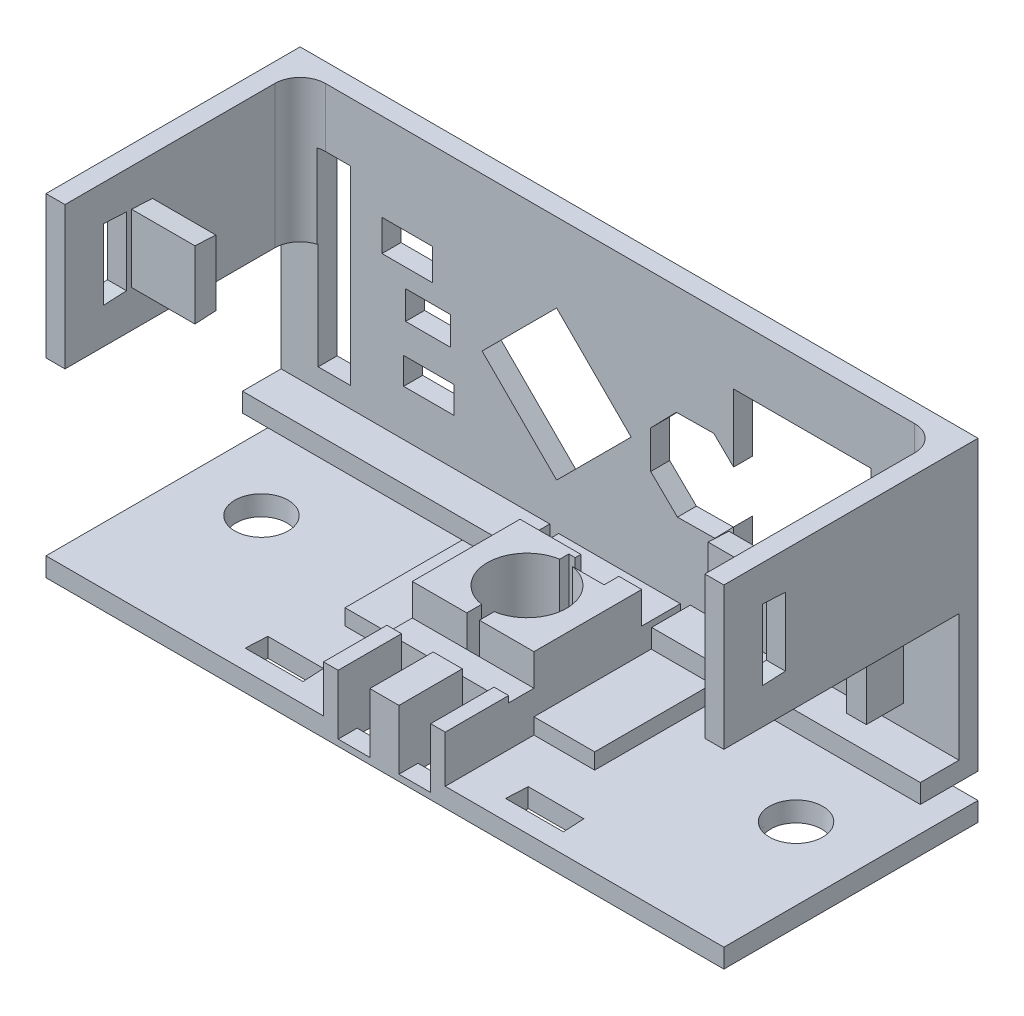
from build123d import *

# Parameters (mm, degrees)
SKETCH1_W                              = 53.48460998
SKETCH1_H                              = 26.25
FRONT_SIDE_MAIN_DEPTH                  = 1.5
RESET_HOLE_DEPTH                       = 3.75
SKETCH15_W                             = 3.966010581
SKETCH15_H                             = 2.112155191
SKETCH15_W_2                           = 3.557190409
SKETCH15_H_2                           = 2.236587576
SKETCH15_W_3                           = 3.981127105
SKETCH15_H_3                           = 2.476855865
COMPONENT_HOLES_DEPTH                  = 3.75
SKETCH16_W                             = 10.85
SKETCH16_H                             = 14.75
MICROPHONE_HOLE_DEPTH                  = 1.5
SKETCH24_W                             = 1.5
SKETCH24_H                             = 11.233042059
RIGHT_SIDE_TOP_DEPTH                   = 18.55
SNAP_GROOVE_RIGHT_DEPTH                = 1.5
SKETCH26_W                             = 1.5
SKETCH26_H                             = 11.23304206
LEFT_SIDE_TOP_DEPTH                    = 18.55
SNAP_START                             = 51.98460998
SNAP_GROOVE_LEFT_DEPTH                 = 1.5
SKETCH20_W                             = 53.48460998
SKETCH20_H                             = 1.5
BOTTOM_BASE_DEPTH                      = 18.55
SERVO_START                            = -1.5
SKETCH18_W                             = 9.6
SKETCH18_H                             = 3.2
SERVO_SEPERATOR_BOTTOM_DEPTH           = 20.05
SKETCH34_W                             = 2.537171882
SKETCH34_H                             = 15
PROGRAMMING_HOLE_DEPTH                 = 3.75
SKETCH38_W                             = 9.6
SKETCH38_H                             = 5
BACK_BATTERY_HOLDER_BOTTOM_DEPTH       = 0.50445794
SKETCH40_R                             = 2
SERVO_ARM_HOLES_BOTTOM_DEPTH           = 1.5
SERVO_ARM_HOLES_BOTTOM_DRAFT           = 4
SERVO_ARM_HOLES_BOTTOM_PROFILE_2_DEPTH = 1.5
SERVO_ARM_HOLES_BOTTOM_PROFILE_2_DRAFT = 4
SKETCH47_W                             = 11
SKETCH47_H                             = 2
SOLAR_ARM_HOLES_FRONT_DEPTH            = 1.5
FILLET1_R                              = 2
SKETCH48_W                             = 9.6
SKETCH48_H                             = 8.5
SERVO_TALLER_SEPERATOR_BOTTOM_DEPTH    = 2.5
SKETCH49_W                             = 1.573389805
SKETCH49_H                             = 10.535992885
SERVO_2_CASE_SPACER_FRONT_DEPTH        = 2.95
SKETCH51_W                             = 4.791370676
SKETCH51_H                             = 11.55
SKETCH51_W_2                           = 5.306259021
SERVO_LIFTERS_BOTTOM_DEPTH             = 1.25
SKETCH52_W                             = 21.2
SKETCH52_H                             = 1.5
SERVO_UNDER_SUPPORT_DEPTH              = 3.05
SERVO_TOP_SUPPORT_RIGHT_DEPTH          = 5
SERVO_TOP_SUPPORT_LEFT_DEPTH           = 5
SNAP_GROOVE_BOTTOM_RIGHT_DEPTH         = 1.5
SNAP_GROOVE_BOTTOM_LEFT_DEPTH          = 1.5
VIBRATION_MOTOR_AND_WIRE_HOLES_DEPTH   = 6.2
SKETCH57_W                             = 3
SKETCH57_H                             = 1.16525933
SKETCH57_W_2                           = 1
SKETCH57_H_2                           = 1.45
VIBRATION_WIRE_ROUTING_HOLES_DEPTH     = 2.5
SKETCH60_W                             = 2.5
SKETCH60_H                             = 5
COPPER_HOLES_DEPTH                     = 4.70445794
SKETCH61_W                             = 2.5
SKETCH61_H                             = 2
CUT_EXTRUDE5_DEPTH                     = 0.5
SKETCH62_R                             = 1.25
BOSS_EXTRUDE1_DEPTH                    = 0.6
CUT_EXTRUDE7_START                     = -3.7
CUT_EXTRUDE7_DEPTH                     = 3.7


# Read off the part's stored shape, not the designer's step: Snap Groove - Right, Snap Groove - Left, Snap Groove - Bottom Right, Snap Groove - Bottom Left, Cut-Extrude7
with BuildPart() as part:
    # Sketch1 → Front Side - Main (new body)
    with BuildSketch(Plane.XY):
        with Locations((26.74230499, 13.125)):
            Rectangle(SKETCH1_W, SKETCH1_H)
    extrude(amount=FRONT_SIDE_MAIN_DEPTH)

    # Reset Hole Sketch → Reset Hole (cut)
    with BuildSketch(Plane(origin=(0, 0, 3.75), x_dir=(-1, 0, 0), z_dir=(0, 0, -1))):
        Polygon((-31.190735744, 17.626168756), (-34.141748042, 17.658585925), (-36.251351249, 15.594827519), (-36.283768419, 12.643815222), (-34.220010013, 10.534212015), (-31.268997715, 10.501794845), (-29.159394508, 12.565553251), (-29.126977338, 15.516565548), align=None)
    extrude(amount=RESET_HOLE_DEPTH, mode=Mode.SUBTRACT)

    # Sketch15 → Component Holes (cut)
    with BuildSketch(Plane(origin=(0, 0, 3.75), x_dir=(-1, 0, 0), z_dir=(0, 0, -1))):
        Polygon((-21.737702993, 20.027277789), (-15.857179586, 14.146754382), (-21.737702993, 8.266230975), (-27.6182264, 14.146754382), align=None)
        with Locations((-11.649935563, 9.695513201)):
            Rectangle(SKETCH15_W, SKETCH15_H)
        with Locations((-11.599935563, 14.270513201)):
            Rectangle(SKETCH15_W_2, SKETCH15_H_2)
        with Locations((-9.949935563, 18.095513201)):
            Rectangle(SKETCH15_W_3, SKETCH15_H_3)
    extrude(amount=COMPONENT_HOLES_DEPTH, mode=Mode.SUBTRACT)

    # Sketch16 → Microphone Hole (cut)
    with BuildSketch(Plane(origin=(0, 0, 0), x_dir=(-1, 0, 0), z_dir=(0, 0, -1))):
        with Locations((-41.124935562, 14.1)):
            Rectangle(SKETCH16_W, SKETCH16_H)
    extrude(amount=-MICROPHONE_HOLE_DEPTH, mode=Mode.SUBTRACT)

    # Sketch24 → Right Side - Top (add)
    with BuildSketch(Plane.XY.offset(1.5)):
        with Locations((0.75, 20.633478971)):
            Rectangle(SKETCH24_W, SKETCH24_H)
    extrude(amount=RIGHT_SIDE_TOP_DEPTH)

    # Snap Groove - Right outline → Snap Groove - Right (cut)
    with BuildSketch(Plane.YZ):
        Polygon((17.938719749, 15.2), (23.328238193, 15.2), (23.422572195, 17), (17.844385746, 17), align=None)
    extrude(amount=SNAP_GROOVE_RIGHT_DEPTH, mode=Mode.SUBTRACT)

    # Sketch26 → Left Side - Top (add)
    with BuildSketch(Plane.XY.offset(1.5)):
        with Locations((52.73460998, 20.63347897)):
            Rectangle(SKETCH26_W, SKETCH26_H)
    extrude(amount=LEFT_SIDE_TOP_DEPTH)

    # Snap Groove - Left outline → Snap Groove - Left (cut)
    with BuildSketch(Plane.YZ.offset(SNAP_START)):
        Polygon((17.938719748, 15.2), (23.328238192, 15.2), (23.422572195, 17), (17.844385746, 17), align=None)
    extrude(amount=SNAP_GROOVE_LEFT_DEPTH, mode=Mode.SUBTRACT)

    # Sketch18 → Servo Seperator - Bottom (add)
    with BuildSketch(Plane.XY.offset(1.5).offset(SERVO_START)):
        with Locations((26.7, 3.1)):
            Rectangle(SKETCH18_W, SKETCH18_H)
    extrude(amount=SERVO_SEPERATOR_BOTTOM_DEPTH)

    # Sketch34 → Programming Hole (cut)
    with BuildSketch(Plane(origin=(0, 0, 0), x_dir=(-1, 0, 0), z_dir=(0, 0, -1))):
        with Locations((-4.194161079, 14.100049249)):
            Rectangle(SKETCH34_W, SKETCH34_H)
    extrude(amount=-PROGRAMMING_HOLE_DEPTH, mode=Mode.SUBTRACT)

    # Sketch38 → Back Battery Holder - Bottom (add)
    with BuildSketch(Plane(origin=(0, 4.7, 0), x_dir=(1, 0, 0), z_dir=(0, 1, 0))):
        with Locations((26.7, -17.55)):
            Rectangle(SKETCH38_W, SKETCH38_H)
    extrude(amount=BACK_BATTERY_HOLDER_BOTTOM_DEPTH)

    # Sketch47 → Solar Arm Holes - Front (cut)
    with BuildSketch(Plane(origin=(0, 0, 0), x_dir=(-1, 0, 0), z_dir=(0, 0, -1))):
        with Locations((-47.98460998, 2.5)):
            Rectangle(SKETCH47_W, SKETCH47_H)
        with Locations((-5.5, 2.5)):
            Rectangle(SKETCH47_W, SKETCH47_H)
    extrude(amount=-SOLAR_ARM_HOLES_FRONT_DEPTH, mode=Mode.SUBTRACT)

    # Fillet1
    # the kernel refuses this fillet: 2 mm, written as the material it adds along each edge
    with BuildSketch(Plane(origin=(1.5, 26.25, 1.5), x_dir=(1, 0, 0), z_dir=(0, -1, 0))) as fillet1_piece_1_section:
        with BuildLine():
            CenterArc((FILLET1_R, FILLET1_R), FILLET1_R, 180, 90)
            Line((0, FILLET1_R), (0, 0))
            Line((0, 0), (FILLET1_R, 0))
        make_face()
    fillet1_piece_1 = extrude(amount=11.233042059, mode=Mode.PRIVATE)
    fillet1_piece_1 = split(fillet1_piece_1, bisect_by=Plane(origin=(3.153594052, 21.600049249, 1.498546269), z_dir=(0, 1, 0)), keep=Keep.TOP, mode=Mode.PRIVATE)
    fillet1_piece_1 = split(fillet1_piece_1, bisect_by=Plane(origin=(2.925575138, 23.925024625, 1.498546269), z_dir=(1, 0, 0)), keep=Keep.TOP, mode=Mode.PRIVATE)
    add(fillet1_piece_1)
    with BuildSketch(Plane(origin=(1.5, 26.25, 1.5), x_dir=(1, 0, 0), z_dir=(0, -1, 0))) as fillet1_piece_2_section:
        with BuildLine():
            CenterArc((FILLET1_R, FILLET1_R), FILLET1_R, 180, 90)
            Line((0, FILLET1_R), (0, 0))
            Line((0, 0), (FILLET1_R, 0))
        make_face()
    fillet1_piece_2 = extrude(amount=11.233042059, mode=Mode.PRIVATE)
    fillet1_piece_2 = split(fillet1_piece_2, bisect_by=Plane(origin=(1.90508607, 21.600049249, 1.970835912), z_dir=(0, 1, 0)), keep=Keep.TOP, mode=Mode.PRIVATE)
    fillet1_piece_2 = split(fillet1_piece_2, bisect_by=Plane(origin=(2.925575138, 23.925024625, 1.970835912), z_dir=(-1, 0, 0)), keep=Keep.TOP, mode=Mode.PRIVATE)
    add(fillet1_piece_2)
    with BuildSketch(Plane(origin=(1.5, 26.25, 1.5), x_dir=(1, 0, 0), z_dir=(0, -1, 0))) as fillet1_piece_3_section:
        with BuildLine():
            CenterArc((FILLET1_R, FILLET1_R), FILLET1_R, 180, 90)
            Line((0, FILLET1_R), (0, 0))
            Line((0, 0), (FILLET1_R, 0))
        make_face()
    fillet1_piece_3 = extrude(amount=11.233042059, mode=Mode.PRIVATE)
    fillet1_piece_3 = split(fillet1_piece_3, bisect_by=Plane(origin=(1.90508607, 21.600049249, 1.970835912), z_dir=(0, -1, 0)), keep=Keep.TOP, mode=Mode.PRIVATE)
    fillet1_piece_3 = split(fillet1_piece_3, bisect_by=Plane(origin=(2.925575138, 18.308503595, 1.970835912), z_dir=(-1, 0, 0)), keep=Keep.TOP, mode=Mode.PRIVATE)
    add(fillet1_piece_3)
    with BuildSketch(Plane(origin=(51.98460998, 26.25, 1.5), x_dir=(-1, 0, 0), z_dir=(0, -1, 0))) as fillet1_piece_4:
        with BuildLine():
            CenterArc((FILLET1_R, -FILLET1_R), FILLET1_R, 90, 90)
            Line((0, -FILLET1_R), (0, 0))
            Line((0, 0), (FILLET1_R, 0))
        make_face()
    extrude(amount=11.23304206)

    # Sketch48 → Servo Taller Seperator - Bottom (add)
    with BuildSketch(Plane(origin=(0, 4.7, 0), x_dir=(1, 0, 0), z_dir=(0, 1, 0))):
        with Locations((26.7, -8.8)):
            Rectangle(SKETCH48_W, SKETCH48_H)
    extrude(amount=SERVO_TALLER_SEPERATOR_BOTTOM_DEPTH)

    # Sketch49 → Servo 2 Case Spacer - Front (add)
    with BuildSketch(Plane.XY.offset(1.5)):
        with Locations((48.336630465, 11.992996443)):
            Rectangle(SKETCH49_W, SKETCH49_H)
    extrude(amount=SERVO_2_CASE_SPACER_FRONT_DEPTH)

    # Sketch51 → Servo Lifters - Bottom (add)
    with BuildSketch(Plane(origin=(0, 1.5, 0), x_dir=(1, 0, 0), z_dir=(0, 1, 0))):
        with Locations((33.895685338, -7.275)):
            Rectangle(SKETCH51_W, SKETCH51_H)
        with Locations((19.24687049, -7.275)):
            Rectangle(SKETCH51_W_2, SKETCH51_H)
    extrude(amount=SERVO_LIFTERS_BOTTOM_DEPTH)

    # Sketch52 → Servo Under Support (add)
    with BuildSketch(Plane.XY.offset(1.5)):
        with Locations((10.6, 4.25)):
            Rectangle(SKETCH52_W, SKETCH52_H)
        with Locations((42.88460998, 4.25)):
            Rectangle(SKETCH52_W, SKETCH52_H)
    extrude(amount=SERVO_UNDER_SUPPORT_DEPTH)

    # Sketch53 → Servo Top Support - Right (add)
    with BuildSketch(Plane(origin=(1.5, 0, 0), x_dir=(0, 0, -1), z_dir=(1, 0, 0))):
        Polygon((-14.8, 23.307275081), (-13.15, 23.220802245), (-13.15, 18.046155696), (-14.8, 17.95968286), align=None)
    extrude(amount=SERVO_TOP_SUPPORT_RIGHT_DEPTH)

    # Sketch55 → Servo Top Support - Left (add)
    with BuildSketch(Plane.ZY.offset(-51.98460998)):
        Polygon((14.8, 17.95968286), (14.8, 23.307275081), (13.15, 23.220802245), (13.15, 18.046155696), align=None)
    extrude(amount=SERVO_TOP_SUPPORT_LEFT_DEPTH)


with BuildPart() as body_2:
    # Sketch20 → Bottom Base (new body)
    with BuildSketch(Plane.XY.offset(1.5)):
        with Locations((26.74230499, 0.75)):
            Rectangle(SKETCH20_W, SKETCH20_H)
    extrude(amount=BOTTOM_BASE_DEPTH)


with BuildPart() as servo_arm_holes_bottom_tool:
    # Sketch40 → Servo arm Holes - Bottom (with draft: the straight prism first)
    with BuildSketch(Plane.XZ):
        with Locations((47.75839301, 8.62692576)):
            Circle(SKETCH40_R)
    extrude(amount=-SERVO_ARM_HOLES_BOTTOM_DEPTH)
    # Servo arm Holes - Bottom: the draft: its side faces are tilted about the plane it starts from
    servo_arm_holes_bottom_sides = [servo_arm_holes_bottom_tool.faces().sort_by_distance(p)[0] for p in [
        (45.75839301, 0.75, 8.62692576),
    ]]
    draft(servo_arm_holes_bottom_sides, Plane.XZ, SERVO_ARM_HOLES_BOTTOM_DRAFT)


with BuildPart() as body_2_1:
    add(body_2.part)

    # Servo arm Holes - Bottom: cut by servo_arm_holes_bottom_tool
    add(servo_arm_holes_bottom_tool.part, mode=Mode.SUBTRACT)


with BuildPart() as servo_arm_holes_bottom_profile_2_tool:
    # Sketch40 → Servo arm Holes - Bottom profile 2 (with draft: the straight prism first)
    with BuildSketch(Plane.XZ):
        with Locations((5.75, 8.8)):
            Circle(SKETCH40_R)
    extrude(amount=-SERVO_ARM_HOLES_BOTTOM_PROFILE_2_DEPTH)
    # Servo arm Holes - Bottom profile 2: the draft: its side faces are tilted about the plane it starts from
    servo_arm_holes_bottom_profile_2_sides = [servo_arm_holes_bottom_profile_2_tool.faces().sort_by_distance(p)[0] for p in [
        (3.75, 0.75, 8.8),
    ]]
    draft(servo_arm_holes_bottom_profile_2_sides, Plane.XZ, SERVO_ARM_HOLES_BOTTOM_PROFILE_2_DRAFT)


with BuildPart() as body_2_2:
    add(body_2_1.part)

    # Servo arm Holes - Bottom profile 2: cut by servo_arm_holes_bottom_profile_2_tool
    add(servo_arm_holes_bottom_profile_2_tool.part, mode=Mode.SUBTRACT)

    # Snap Groove - Bottom Right outline → Snap Groove - Bottom Right (cut)
    with BuildSketch(Plane(origin=(0, 0, 0), x_dir=(1, 0, 0), z_dir=(0, 1, 0))):
        Polygon((18.644759222, -16.8), (14.255240778, -16.8), (14.166147553, -18.5), (18.733852447, -18.5), align=None)
    extrude(amount=SNAP_GROOVE_BOTTOM_RIGHT_DEPTH, mode=Mode.SUBTRACT)

    # Snap Groove - Bottom Left outline → Snap Groove - Bottom Left (cut)
    with BuildSketch(Plane(origin=(0, 0, 0), x_dir=(1, 0, 0), z_dir=(0, 1, 0))):
        Polygon((39.276157437, -18.5), (39.187064212, -16.8), (34.797545768, -16.8), (34.708452543, -18.5), align=None)
    extrude(amount=SNAP_GROOVE_BOTTOM_LEFT_DEPTH, mode=Mode.SUBTRACT)


with BuildPart() as vibration_motor_and_wire_holes_tool:
    # Sketch56 → vibration motor and wire holes (new body)
    with BuildSketch(Plane(origin=(0, 7.2, 0), x_dir=(1, 0, 0), z_dir=(0, 1, 0))):
        with BuildLine():
            ThreePointArc((27.2, -5.71525933), (26.7, -5.675), (26.2, -5.71525933))
            Line((26.2, -5.71525933), (26.2, -6))
            Line((26.2, -6), (27.2, -6))
            Line((27.2, -6), (27.2, -5.71525933))
        make_face()
        with BuildLine():
            Line((26.2, -6), (26.2, -5.71525933))
            ThreePointArc((26.2, -5.71525933), (24.674768532, -11.179929096), (29.825, -8.8))
            ThreePointArc((29.825, -8.8), (29.079929096, -6.774768532), (27.2, -5.71525933))
            Line((27.2, -5.71525933), (27.2, -6))
            Line((27.2, -6), (26.2, -6))
        make_face()
        with BuildLine():
            Line((27.2, -5), (26.2, -5))
            Line((26.2, -5), (26.2, -5.71525933))
            ThreePointArc((26.2, -5.71525933), (26.7, -5.675), (27.2, -5.71525933))
            Line((27.2, -5.71525933), (27.2, -5))
        make_face()
    extrude(amount=-VIBRATION_MOTOR_AND_WIRE_HOLES_DEPTH)


with BuildPart() as part_1:
    add(part.part)

    # vibration motor and wire holes: cut by vibration_motor_and_wire_holes_tool
    add(vibration_motor_and_wire_holes_tool.part, mode=Mode.SUBTRACT)

    # Sketch57 → vibration wire routing holes (cut)
    with BuildSketch(Plane(origin=(0, 7.2, 0), x_dir=(1, 0, 0), z_dir=(0, 1, 0))):
        with Locations((28.2, -5.132629665)):
            Rectangle(SKETCH57_W, SKETCH57_H)
        with Locations((26.7, -12.325)):
            Rectangle(SKETCH57_W_2, SKETCH57_H_2)
    extrude(amount=-VIBRATION_WIRE_ROUTING_HOLES_DEPTH, mode=Mode.SUBTRACT)


with BuildPart() as body_2_3:
    add(body_2_2.part)

    # vibration motor and wire holes: cut by vibration_motor_and_wire_holes_tool
    add(vibration_motor_and_wire_holes_tool.part, mode=Mode.SUBTRACT)


with BuildPart() as copper_holes_tool:
    # Sketch60 → copper holes (new body)
    with BuildSketch(Plane(origin=(0, 5.20445794, 0), x_dir=(1, 0, 0), z_dir=(0, 1, 0))):
        with Locations((24.3, -17.55)):
            Rectangle(SKETCH60_W, SKETCH60_H)
        with Locations((29.1, -17.55)):
            Rectangle(SKETCH60_W, SKETCH60_H)
    extrude(amount=-COPPER_HOLES_DEPTH)


with BuildPart() as part_2:
    add(part_1.part)

    # copper holes: cut by copper_holes_tool
    add(copper_holes_tool.part, mode=Mode.SUBTRACT)



with BuildPart() as body_2_4:
    add(body_2_3.part)

    # copper holes: cut by copper_holes_tool
    add(copper_holes_tool.part, mode=Mode.SUBTRACT)

    # Sketch61 → Cut-Extrude5 (cut)
    with BuildSketch(Plane.XZ):
        with Locations((24.3, 17.55)):
            Rectangle(SKETCH61_W, SKETCH61_H)
        with Locations((29.1, 17.55)):
            Rectangle(SKETCH61_W, SKETCH61_H)
    extrude(amount=-CUT_EXTRUDE5_DEPTH, mode=Mode.SUBTRACT)


with BuildPart() as part_3:
    add(part_2.part)

    add(body_2_4.part)  # Boss-Extrude1 merges body 2
    # Sketch62 → Boss-Extrude1 (add)
    with BuildSketch(Plane(origin=(0, 1, 0), x_dir=(1, 0, 0), z_dir=(0, 1, 0))):
        with Locations(Location((26.7, -8.8, 0), (0, 0, 270))):
            Circle(SKETCH62_R)
    extrude(amount=BOSS_EXTRUDE1_DEPTH)

    # Cut-Extrude7 outline → Cut-Extrude7 (cut)
    with BuildSketch(Plane(origin=(0, 4.7, 0), x_dir=(1, 0, 0), z_dir=(0, 1, 0)).offset(CUT_EXTRUDE7_START)):
        with BuildLine():
            Line((26.2, -13.05), (27.2, -13.05))
            Line((27.2, -13.05), (27.2, -11.88474067))
            ThreePointArc((27.2, -11.88474067), (26.7, -11.925), (26.2, -11.88474067))
            Line((26.2, -11.88474067), (26.2, -13.05))
        make_face()
    extrude(amount=CUT_EXTRUDE7_DEPTH, mode=Mode.SUBTRACT)


solid = part_3.part
